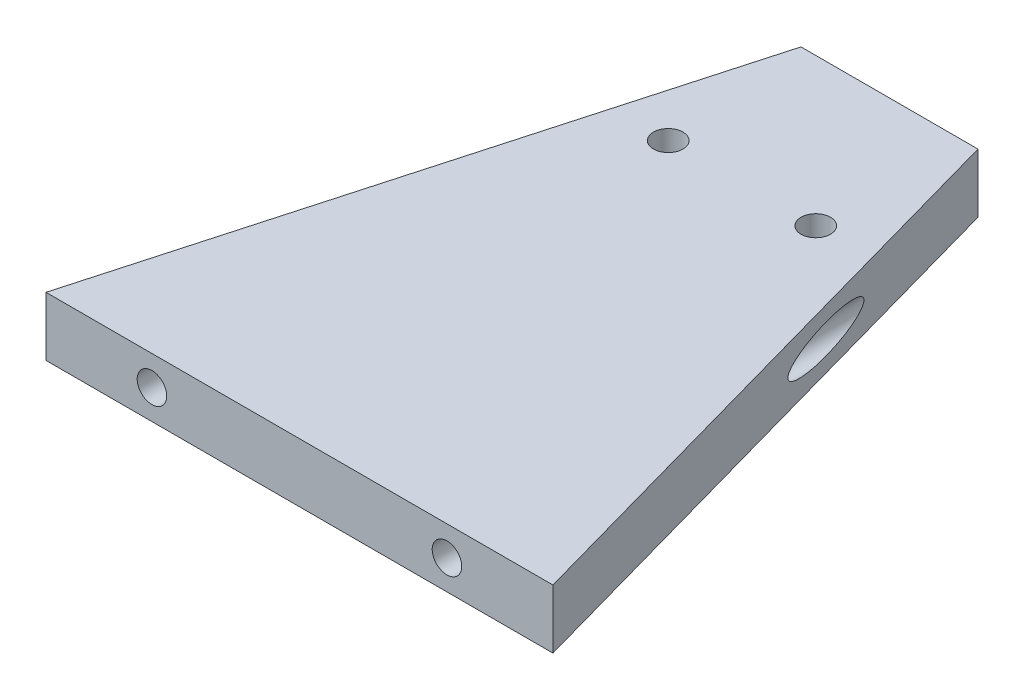
from build123d import *

# Parameters (mm, degrees)
SKETCH1_R           = 3.175
BOSS_EXTRUDE1_DEPTH = 12.7
SKETCH3_R           = 3.175
CUT_EXTRUDE1_DEPTH  = 143.557146436
CUT_EXTRUDE2_DEPTH  = 143.557146436


with BuildPart() as part:
    # Sketch1 → Boss-Extrude1 (new body)
    with BuildSketch(Plane(origin=(0, 0, 0), x_dir=(1, 0, 0), z_dir=(0, 1, 0))):
        Polygon((0, 127), (63.5, 127), (63.5, 0), (-63.5, 0), (-63.5, 127), align=None)
        with Locations((-15.875, 95.25)):
            Circle(SKETCH1_R, mode=Mode.SUBTRACT)
        with Locations((15.875, 95.25)):
            Circle(SKETCH1_R, mode=Mode.SUBTRACT)
    extrude(amount=BOSS_EXTRUDE1_DEPTH)

    # Sketch3 → Cut-Extrude1 (cut, through all)
    with BuildSketch(Plane.XY):
        with Locations((-31.75, 6.35)):
            Circle(SKETCH3_R)
        with Locations((31.75, 6.35)):
            Circle(SKETCH3_R)
    extrude(amount=-CUT_EXTRUDE1_DEPTH, mode=Mode.SUBTRACT)

    # Sketch4 → Cut-Extrude2 (cut, through all)
    with BuildSketch(Plane(origin=(0, 12.7, 0), x_dir=(1, 0, 0), z_dir=(0, 1, 0))):
        Polygon((-63.5, -32.004), (-19.05, 127), (-63.5, 127), align=None)
        Polygon((19.05, 127), (63.5, -32.004), (63.5, 127), align=None)
    extrude(amount=-CUT_EXTRUDE2_DEPTH, mode=Mode.SUBTRACT)


solid = part.part
